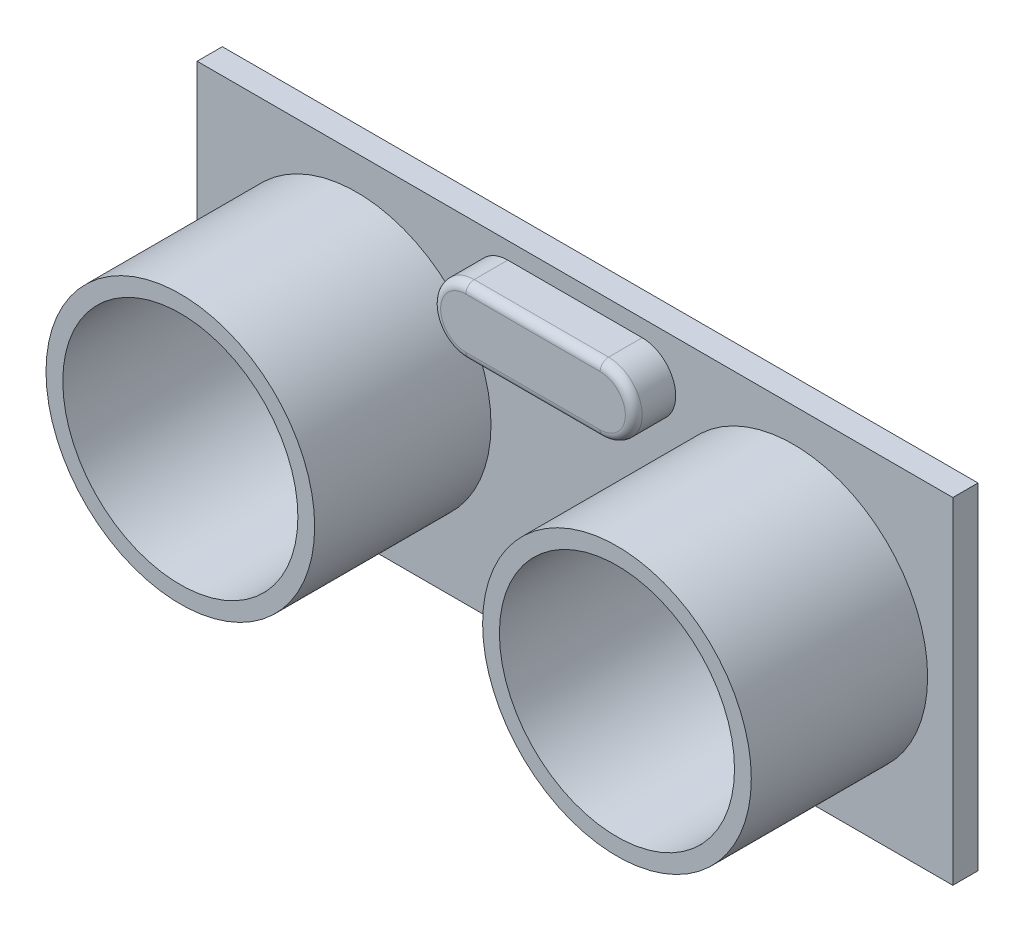
from build123d import *

# Parameters (mm, degrees)
SKETCH1_R             = 8
SKETCH1_R_2           = 7
BOSS_EXTRUDE1_DEPTH   = 12
BOSS_EXTRUDE1_2_DEPTH = 12
SKETCH1_4_W           = 45
SKETCH1_4_H           = 20
SKETCH1_4_R           = 8
BOSS_EXTRUDE2_DEPTH   = 1.5
BOSS_EXTRUDE3_DEPTH   = 4
FILLET1_R             = 0.5
BOSS_EXTRUDE5_DEPTH   = 2
LPATTERN1_COUNT       = 4
LPATTERN1_PITCH       = 2
SKETCH10_R            = 0.2
LPATTERN2_COUNT       = 4
LPATTERN2_PITCH       = 2


with BuildPart() as part:
    # Sketch1 → Boss-Extrude1 (new body)
    with BuildSketch(Plane.XY):
        with Locations((13, 0)):
            Circle(SKETCH1_R)
        with Locations((13, 0)):
            Circle(SKETCH1_R_2, mode=Mode.SUBTRACT)
    extrude(amount=BOSS_EXTRUDE1_DEPTH)



with BuildPart() as body_2:
    # Sketch1 → Boss-Extrude1 2 (new body)
    with BuildSketch(Plane.XY):
        with Locations((-13, 0)):
            Circle(SKETCH1_R)
        with Locations((-13, 0)):
            Circle(SKETCH1_R_2, mode=Mode.SUBTRACT)
    extrude(amount=BOSS_EXTRUDE1_2_DEPTH)


with BuildPart() as part_1:
    add(part.part)

    add(body_2.part)  # Boss-Extrude2 merges body 2
    # Sketch1<4> → Boss-Extrude2 (add)
    with BuildSketch(Plane.XY):
        Rectangle(SKETCH1_4_W, SKETCH1_4_H)
        with Locations((-13, 0)):
            Circle(SKETCH1_4_R, mode=Mode.SUBTRACT)
        with Locations((13, 0)):
            Circle(SKETCH1_4_R, mode=Mode.SUBTRACT)
        with BuildLine():
            ThreePointArc((-4, 4.991849634), (-6, 6.991849634), (-4, 8.991849634))
            Line((-4, 8.991849634), (4, 8.991849634))
            ThreePointArc((4, 8.991849634), (6, 6.991849634), (4, 4.991849634))
            Line((4, 4.991849634), (-4, 4.991849634))
        make_face(mode=Mode.SUBTRACT)
    extrude(amount=BOSS_EXTRUDE2_DEPTH)

    # Sketch1<5> → Boss-Extrude3 (add)
    with BuildSketch(Plane.XY):
        with BuildLine():
            Line((4, 8.991849634), (-4, 8.991849634))
            ThreePointArc((-4, 8.991849634), (-6, 6.991849634), (-4, 4.991849634))
            Line((-4, 4.991849634), (4, 4.991849634))
            ThreePointArc((4, 4.991849634), (6, 6.991849634), (4, 8.991849634))
        make_face()
    extrude(amount=BOSS_EXTRUDE3_DEPTH)

    # Fillet1
    fillet1_edges = [part_1.edges().sort_by_distance(p)[0] for p in [
        (-6, 6.991849634, 4),
        (0, 4.991849634, 4),
        (6, 6.991849634, 4),
        (0, 8.991849634, 4),
    ]]
    fillet(fillet1_edges, radius=FILLET1_R)

    # Sketch2 → Boss-Extrude5 (add)
    with BuildSketch(Plane(origin=(0, 0, 0), x_dir=(-1, 0, 0), z_dir=(0, 0, -1))):
        with BuildLine():
            Line((3, -6.05656326), (4, -6.05656326))
            ThreePointArc((4, -6.05656326), (4.353553391, -6.203009869), (4.5, -6.55656326))
            Line((4.5, -6.55656326), (4.5, -7.55656326))
            ThreePointArc((4.5, -7.55656326), (4.353553391, -7.91011665), (4, -8.05656326))
            Line((4, -8.05656326), (3, -8.05656326))
            ThreePointArc((3, -8.05656326), (2.646446609, -7.91011665), (2.5, -7.55656326))
            Line((2.5, -7.55656326), (2.5, -6.55656326))
            ThreePointArc((2.5, -6.55656326), (2.646446609, -6.203009869), (3, -6.05656326))
        make_face()
    boss_extrude5 = extrude(amount=BOSS_EXTRUDE5_DEPTH)

    # LPattern1: Boss-Extrude5 ×4
    with Locations(*[(i * LPATTERN1_PITCH, 0, 0) for i in range(1, LPATTERN1_COUNT)]):
        add(boss_extrude5)

    # Sweep1: sweep along a path in Sketch9
    with BuildLine(Plane(origin=(2.5, 0, 0), x_dir=(0, 0, -1), z_dir=(1, 0, 0))) as sweep1_path:
        Line((2, -7.056575607), (2.1, -7.056575607))
        ThreePointArc((2.1, -7.056575607), (2.382842712, -7.173732894), (2.5, -7.456575607))
        Line((2.5, -7.456575607), (2.5, -13.056575607))
    # Sketch10 → Sweep1 (sweep)
    with BuildSketch(Plane(origin=(0, 0, -2), x_dir=(-1, 0, 0), z_dir=(0, 0, -1))):
        with Locations((-2.5, -7.056575607)):
            Circle(SKETCH10_R)
    sweep1 = sweep(path=sweep1_path.line)

    # LPattern2: Sweep1 ×4
    with Locations(*[(-i * LPATTERN2_PITCH, 0, 0) for i in range(1, LPATTERN2_COUNT)]):
        add(sweep1)


solid = part_1.part
